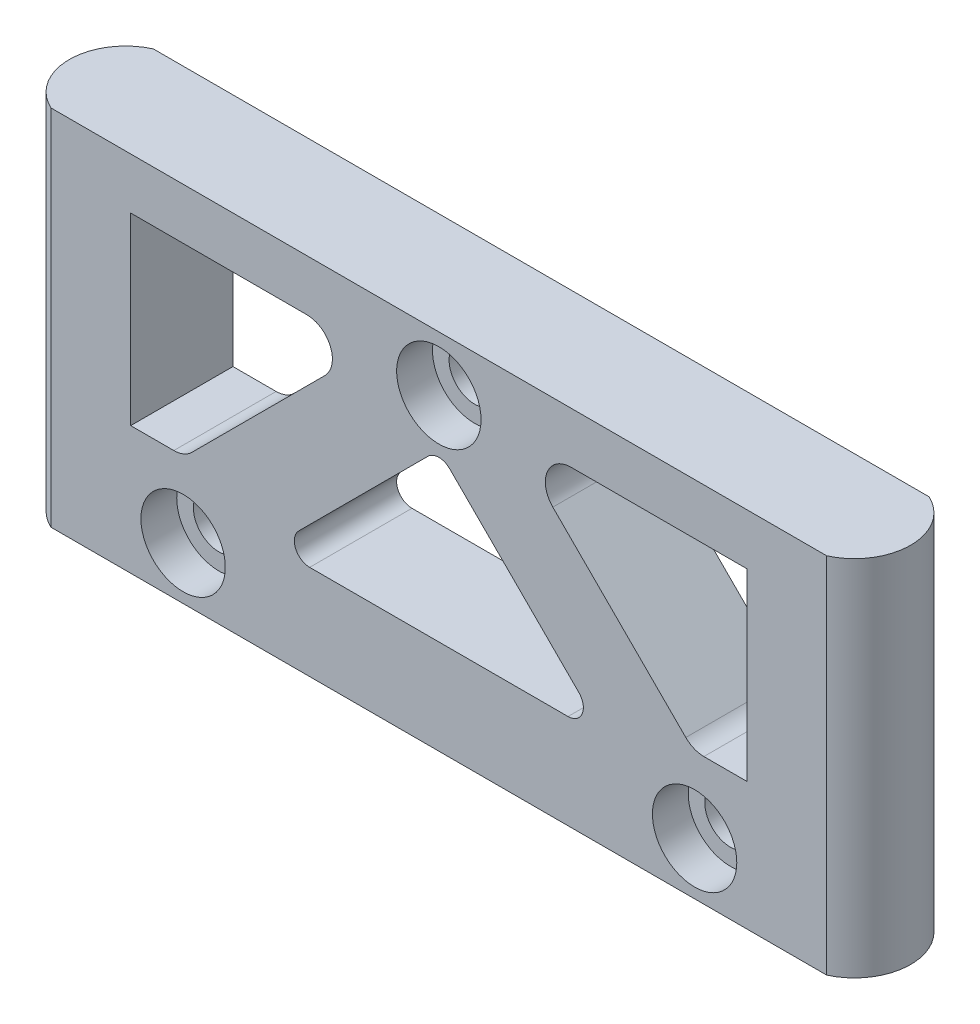
from build123d import *

# Parameters (mm, degrees)
BOSS_EXTRUDE4_DEPTH      = 20
SKETCH3_R                = 8.25
CUT_EXTRUDE1_DEPTH       = 7
CUT_EXTRUDE2_START       = -7
SKETCH4_R                = 8.25
CUT_EXTRUDE2_DEPTH       = 7
CUT_EXTRUDE3_DEPTH       = 128.220772675
SKETCH6_R                = 5
CUT_EXTRUDE4_DEPTH       = 16.6
FILLET1_R                = 3
BOSS_EXTRUDE5_DEPTH      = 20
BOSS_EXTRUDE6_DEPTH      = 46
BOSS_EXTRUDE6_DEPTH_BACK = 25
SKETCH8_R                = 11
SKETCH8_R_2              = 8.25
BOSS_EXTRUDE7_REACH      = 138.572
SKETCH9_W                = 20
SKETCH9_H                = 10
FILLET2_R                = 5
FILLET5_R                = 5
SKETCH10_W               = 60.25
SKETCH10_H               = 70.5
CUT_EXTRUDE5_DEPTH       = 128.619062056
BOSS_EXTRUDE8_DEPTH      = 20
BOSS_EXTRUDE9_START      = -20
SKETCH12_R               = 11
BOSS_EXTRUDE9_DEPTH      = 20
SKETCH13_OUTSIDE_W       = 202.602
SKETCH13_OUTSIDE_H       = 60.102
SKETCH13_OUTSIDE_W_2     = 164.5
SKETCH13_OUTSIDE_H_2     = 20
CUT_EXTRUDE6_DEPTH       = 152.565373684


with BuildPart() as part:
    # Sketch2 → Boss-Extrude4 (new body)
    with BuildSketch(Plane.XY):
        with BuildLine():
            Line((-100, 10.25), (0, 10.25))
            ThreePointArc((0, 10.25), (10.25, 0), (0, -10.25))
            Line((0, -10.25), (-100, -10.25))
            ThreePointArc((-100, -10.25), (-110.25, 0), (-100, 10.25))
        make_face()
        with BuildLine():
            Line((-7.247844507, -7.247844507), (-57.247844507, 42.752155493))
            ThreePointArc((-57.247844507, 42.752155493), (-57.247844507, 57.247844507), (-42.752155493, 57.247844507))
            Line((-42.752155493, 57.247844507), (7.247844507, 7.247844507))
            ThreePointArc((7.247844507, 7.247844507), (7.247844507, -7.247844507), (-7.247844507, -7.247844507))
        make_face()
        with BuildLine():
            Line((-107.247844507, 7.247844507), (-57.247844507, 57.247844507))
            ThreePointArc((-57.247844507, 57.247844507), (-42.752155493, 57.247844507), (-42.752155493, 42.752155493))
            Line((-42.752155493, 42.752155493), (-92.752155493, -7.247844507))
            ThreePointArc((-92.752155493, -7.247844507), (-107.247844507, -7.247844507), (-107.247844507, 7.247844507))
        make_face()
    extrude(amount=BOSS_EXTRUDE4_DEPTH)

    # Sketch3 → Cut-Extrude1 (cut)
    with BuildSketch(Plane(origin=(0, 0, 0), x_dir=(-1, 0, 0), z_dir=(0, 0, -1))):
        Circle(SKETCH3_R)
        with Locations((50, 50)):
            Circle(SKETCH3_R)
        with Locations((100, 0)):
            Circle(SKETCH3_R)
    extrude(amount=-CUT_EXTRUDE1_DEPTH, mode=Mode.SUBTRACT)

    # Sketch4 → Cut-Extrude2 (cut)
    with BuildSketch(Plane.XY.offset(20).offset(CUT_EXTRUDE2_START)):
        with Locations(Location((-100, 0, 0), (0, 0, 180))):
            Circle(SKETCH4_R)
        with Locations(Location((-50, 50, 0), (0, 0, 180))):
            Circle(SKETCH4_R)
        with Locations(Location((0, 0, 0), (0, 0, 180))):
            Circle(SKETCH4_R)
    extrude(amount=CUT_EXTRUDE2_DEPTH, mode=Mode.SUBTRACT)

    # Sketch5 → Cut-Extrude3 (cut, through all)
    with BuildSketch(Plane(origin=(0, 0, 0), x_dir=(-1, 0, 0), z_dir=(0, 0, -1))):
        Polygon((17.5, 8.25), (50, 40.75), (82.5, 8.25), align=None)
    extrude(amount=-CUT_EXTRUDE3_DEPTH, mode=Mode.SUBTRACT)

    # Sketch6 → Cut-Extrude4 (cut)
    with BuildSketch(Plane.XY.offset(20)):
        with Locations((-100, 0)):
            Circle(SKETCH6_R)
        with Locations((-50, 50)):
            Circle(SKETCH6_R)
        Circle(SKETCH6_R)
    extrude(amount=-CUT_EXTRUDE4_DEPTH, mode=Mode.SUBTRACT)

    # Fillet1
    fillet1_edges = [part.edges().sort_by_distance(p)[0] for p in [
        (-82.5, 8.25, 10),
        (-17.5, 8.25, 10),
        (-50, 40.75, 10),
    ]]
    fillet(fillet1_edges, radius=FILLET1_R)

    # Sketch7 → Boss-Extrude5 (add)
    with BuildSketch(Plane(origin=(0, 0, 0), x_dir=(-1, 0, 0), z_dir=(0, 0, -1))):
        with BuildLine():
            Line((-10.25, 14.75), (-10.25, 0))
            ThreePointArc((-10.25, 0), (-9.469765208, 3.922505182), (-7.247844507, 7.247844507))
            Line((-7.247844507, 7.247844507), (0.254310986, 14.75))
            Line((0.254310986, 14.75), (-10.25, 14.75))
        make_face()
        with BuildLine():
            Line((-10.25, -10.25), (0, -10.25))
            ThreePointArc((0, -10.25), (-7.247844507, -7.247844507), (-10.25, 0))
            Line((-10.25, 0), (-10.25, -10.25))
        make_face()
    extrude(amount=-BOSS_EXTRUDE5_DEPTH)

    # Sketch8 → Boss-Extrude6 (add, two sides: drawn at the far end of the back side and taken through both)
    # profile 1 of 3: a face of its own
    with BuildSketch(Plane(origin=(0, 14.75, 0), x_dir=(1, 0, 0), z_dir=(0, 1, 0)).offset(-BOSS_EXTRUDE6_DEPTH_BACK)):
        with BuildLine():
            Line((10.25, 0), (10.25, -10))
            ThreePointArc((10.25, -10), (13.110659193, -2.600599266), (20.204751131, 0.950226244))
            Line((20.204751131, 0.950226244), (10.25, 0))
        make_face()
    # profile 2 of 3: a face of its own
    with BuildSketch(Plane(origin=(0, 14.75, 0), x_dir=(1, 0, 0), z_dir=(0, 1, 0)).offset(-BOSS_EXTRUDE6_DEPTH_BACK)):
        with Locations((21.25, -10)):
            Circle(SKETCH8_R)
        with Locations(Location((21.25, -10, 0), (0, 0, 270))):
            Circle(SKETCH8_R_2, mode=Mode.SUBTRACT)
    # profile 3 of 3: a face of its own
    with BuildSketch(Plane(origin=(0, 14.75, 0), x_dir=(1, 0, 0), z_dir=(0, 1, 0)).offset(-BOSS_EXTRUDE6_DEPTH_BACK)):
        with BuildLine():
            Line((10.25, -10), (10.25, -20))
            Line((10.25, -20), (20.204751131, -20.950226244))
            ThreePointArc((20.204751131, -20.950226244), (13.110659193, -17.399400734), (10.25, -10))
        make_face()
    extrude(amount=BOSS_EXTRUDE6_DEPTH + BOSS_EXTRUDE6_DEPTH_BACK)

    # Boss-Extrude7: up to this plane
    boss_extrude7_end = Plane(origin=(7.247844507, 7.247844507, 20), z_dir=(-0.7071067811865439, -0.7071067811865512, 0))
    # Sketch9 → Boss-Extrude7 (add, up to the surface)
    with BuildSketch(Plane.ZY.offset(-10.25), mode=Mode.PRIVATE) as boss_extrude7_sk1:
        with Locations((10, 55.75)):
            Rectangle(SKETCH9_W, SKETCH9_H)
    boss_extrude7_tool1 = split(extrude(boss_extrude7_sk1.sketch, amount=BOSS_EXTRUDE7_REACH, mode=Mode.PRIVATE), bisect_by=boss_extrude7_end, keep=Keep.BOTH, mode=Mode.PRIVATE)
    add(boss_extrude7_tool1.solids().sort_by_distance((10.25, 55.75, 10))[0])

    # Fillet2
    # the kernel refuses this fillet: 5 mm, written as the material it adds along each edge
    with BuildSketch(Plane(origin=(10.25, 14.75, 0), x_dir=(-1, 0, 0), z_dir=(0, -1, 0)), Plane(origin=(10.25, -10.25, 20), x_dir=(-1, 0, 0), z_dir=(0, 1, 0))) as fillet2_piece_1:
        with BuildLine():
            CenterArc((FILLET2_R * 0.047619047619, FILLET2_R), FILLET2_R, 264.547378012, 5.452621988)
            Line((-FILLET2_R * 0.0474035768153, FILLET2_R * 0.00452488687783), (0, 0))
            Line((0, 0), (FILLET2_R * 0.047619047619, 0))
        make_face()
    extrude(amount=25)
    with BuildSketch(Plane(origin=(10.25, 50.75, 0), x_dir=(-1, 0, 0), z_dir=(0, 1, 0)), Plane(origin=(10.25, 60.75, 20), x_dir=(-1, 0, 0), z_dir=(0, -1, 0))) as fillet2_piece_2:
        with BuildLine():
            CenterArc((FILLET2_R * 0.047619047619, -FILLET2_R), FILLET2_R, 90, 5.452621988)
            Line((-FILLET2_R * 0.0474035768153, -FILLET2_R * 0.00452488687783), (0, 0))
            Line((0, 0), (FILLET2_R * 0.047619047619, 0))
        make_face()
    extrude(amount=10)

    # Fillet5
    fillet5_edges = [part.edges().sort_by_distance(p)[0] for p in [
        (-0.254310986, 14.75, 10),
        (-36.254310986, 50.75, 10),
    ]]
    fillet(fillet5_edges, radius=FILLET5_R)

    # Sketch10 → Cut-Extrude5 (cut, through all)
    with BuildSketch(Plane(origin=(0, 0, 0), x_dir=(-1, 0, 0), z_dir=(0, 0, -1))):
        with Locations((80.125, 25)):
            Rectangle(SKETCH10_W, SKETCH10_H)
    extrude(amount=-CUT_EXTRUDE5_DEPTH, mode=Mode.SUBTRACT)

    # Mirror1: part across plane


with BuildPart() as part_1:
    add(part.part)
    add(part.part.mirror(Plane(origin=(-50, -10.25, 21), x_dir=(0, 0, 1), z_dir=(1, 0, 0))))

    # Sketch11 → Boss-Extrude8 (add)
    with BuildSketch(Plane(origin=(0, 0, 0), x_dir=(-1, 0, 0), z_dir=(0, 0, -1))):
        with BuildLine():
            Line((46.254310986, 60.75), (53.745689014, 60.75))
            Line((53.745689014, 60.75), (57.247844507, 57.247844507))
            ThreePointArc((57.247844507, 57.247844507), (50, 60.25), (42.752155493, 57.247844507))
            Line((42.752155493, 57.247844507), (46.254310986, 60.75))
        make_face()
    extrude(amount=-BOSS_EXTRUDE8_DEPTH)

    # Sketch12 → Boss-Extrude9 (add)
    with BuildSketch(Plane(origin=(0, 60.75, 0), x_dir=(1, 0, 0), z_dir=(0, 1, 0)).offset(BOSS_EXTRUDE9_START)):
        with Locations((-121.25, -10)):
            Circle(SKETCH12_R)
        with Locations((21.25, -10)):
            Circle(SKETCH12_R)
    extrude(amount=BOSS_EXTRUDE9_DEPTH)

    # Sketch13 outside → Cut-Extrude6 (cut, through all)
    with BuildSketch(Plane(origin=(0, 60.75, 0), x_dir=(1, 0, 0), z_dir=(0, 1, 0))):
        with Locations((-50, -10)):
            Rectangle(SKETCH13_OUTSIDE_W, SKETCH13_OUTSIDE_H)
        with Locations((-50, -10)):
            Rectangle(SKETCH13_OUTSIDE_W_2, SKETCH13_OUTSIDE_H_2, mode=Mode.SUBTRACT)
    extrude(amount=-CUT_EXTRUDE6_DEPTH, mode=Mode.SUBTRACT)


solid = part_1.part
